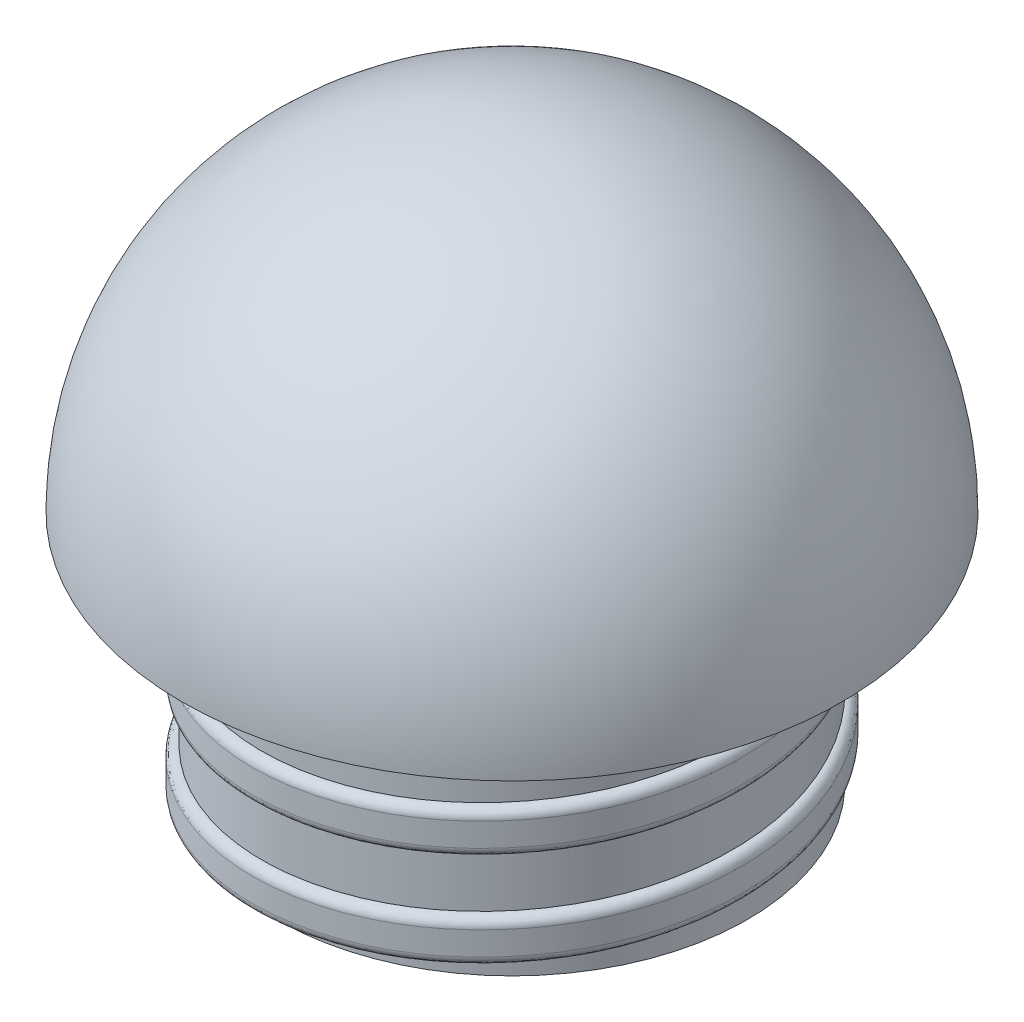
from build123d import *

# Parameters (mm, degrees)
REVOLVE1_ANGLE      = 180
SKETCH2_R           = 5
BOSS_EXTRUDE1_DEPTH = 5
SWEEP1_PITCH        = 2
SKETCH5_W           = 24.567867965
SKETCH5_H           = 1.481381553
CUT_EXTRUDE1_DEPTH  = 25


with BuildPart() as part:
    # Sketch1 → Revolve1 (revolve)
    with BuildSketch(Plane(origin=(0, 0, 0), x_dir=(1, 0, 0), z_dir=(0, 1, 0))):
        with BuildLine():
            Line((-7, 0), (7, 0))
            ThreePointArc((7, 0), (0, 7), (-7, 0))
        make_face()
    revolve(axis=Axis((-7, 0, 0), (1, 0, 0)), revolution_arc=REVOLVE1_ANGLE)

    # Sketch2 → Boss-Extrude1 (add)
    with BuildSketch(Plane(origin=(0, 0, 0), x_dir=(-1, 0, 0), z_dir=(0, -1, 0))):
        with Locations(Location((0, 0, 0), (0, 0, 90))):
            Circle(SKETCH2_R)
    extrude(amount=BOSS_EXTRUDE1_DEPTH)

    # Sweep1: the profile of Sketch4 screwed along a right-hand helix of 2.5 turns, 10 arcs to a turn; built about Z, then put on its axis
    sweep1_z = Axis((0, 0, 0), (0, 0, 1))
    sweep1_corners = [(5.2, 0.01588334, -0.249494929), (5.2, -0.01588334, 0.249494929), (5, -0.028590013, 0.449090872), (4.8, -0.01588334, 0.249494929), (4.8, 0.01588334, -0.249494929), (5, 0.028590013, -0.449090872)]
    with BuildLine(mode=Mode.PRIVATE) as sweep1_profile:
        Line(sweep1_corners[0], sweep1_corners[1])
        Line(sweep1_corners[3], sweep1_corners[4])
        ThreePointArc((5.2, -0.01588334, 0.249494929), (5.141421356, -0.024868315, 0.390630574), (5, -0.028590013, 0.449090872))
        ThreePointArc((5, -0.028590013, 0.449090872), (4.858578644, -0.024868315, 0.390630574), (4.8, -0.01588334, 0.249494929))
        ThreePointArc((4.8, 0.01588334, -0.249494929), (4.858578644, 0.024868315, -0.390630574), (5, 0.028590013, -0.449090872))
        ThreePointArc((5, 0.028590013, -0.449090872), (5.141421356, 0.024868315, -0.390630574), (5.2, 0.01588334, -0.249494929))
    sweep1_cap = Face(sweep1_profile.wire())
    sweep1_arcs = [((5.2, -0.01588334, 0.249494929), (5.2, -0.028590013, 0.449090872), (5, -0.028590013, 0.449090872), (1, 0.7071067811865487, 1)), ((5, -0.028590013, 0.449090872), (4.8, -0.028590013, 0.449090872), (4.8, -0.01588334, 0.249494929), (1, 0.7071067811865487, 1)), ((4.8, 0.01588334, -0.249494929), (4.8, 0.028590013, -0.449090872), (5, 0.028590013, -0.449090872), (1, 0.7071067811865476, 1)), ((5, 0.028590013, -0.449090872), (5.2, 0.028590013, -0.449090872), (5.2, 0.01588334, -0.249494929), (1, 0.7071067811865476, 1))]  # start, shoulder, end, weights
    sweep1_turn_angles = [0, 18, 36, 54, 72, 90, 108, 126, 144, 162, 180, 198, 216, 234, 252, 270, 288, 306, 324, 342, 360]
    sweep1_turn_weights = [1, 0.9510565162951535, 1, 0.9510565162951535, 1, 0.9510565162951535, 1, 0.9510565162951535, 1, 0.9510565162951535, 1, 0.9510565162951535, 1, 0.9510565162951535, 1, 0.9510565162951535, 1, 0.9510565162951535, 1, 0.9510565162951535, 1]
    sweep1_turn_rails = [Edge.make_bspline([Vector(p[0], p[1], 0).rotate(sweep1_z, sweep1_turn_angles[k]) / sweep1_turn_weights[k] + Vector(0, 0, p[2] + SWEEP1_PITCH * sweep1_turn_angles[k] / 360) for k in range(21)], [0, 0, 0, 1, 1, 2, 2, 3, 3, 4, 4, 5, 5, 6, 6, 7, 7, 8, 8, 9, 9, 10, 10, 10], 2, sweep1_turn_weights) for p in sweep1_corners]
    sweep1_turn_sides = [*[Face.make_surface_from_curves(sweep1_turn_rails[p[0]], sweep1_turn_rails[p[1]]) for p in [(0, 1), (3, 4)]], *[Face.make_bezier_surface([[Vector(p[j][0], p[j][1], 0).rotate(sweep1_z, sweep1_turn_angles[2 * i + k]) / sweep1_turn_weights[2 * i + k] + Vector(0, 0, p[j][2] + SWEEP1_PITCH * sweep1_turn_angles[2 * i + k] / 360) for k in range(3)] for j in range(3)], [[p[3][j] * sweep1_turn_weights[2 * i + k] for k in range(3)] for j in range(3)]) for p in sweep1_arcs for i in range(10)]]
    sweep1_last_angles = [720, 738, 756, 774, 792, 810, 828, 846, 864, 882, 900]
    sweep1_last_weights = [1, 0.9510565162951535, 1, 0.9510565162951535, 1, 0.9510565162951535, 1, 0.9510565162951535, 1, 0.9510565162951483, 1]
    sweep1_last_rails = [Edge.make_bspline([Vector(p[0], p[1], 0).rotate(sweep1_z, sweep1_last_angles[k]) / sweep1_last_weights[k] + Vector(0, 0, p[2] + SWEEP1_PITCH * sweep1_last_angles[k] / 360) for k in range(11)], [0, 0, 0, 1, 1, 2, 2, 3, 3, 4, 4, 5, 5, 5], 2, sweep1_last_weights) for p in sweep1_corners]
    sweep1_last_sides = [*[Face.make_surface_from_curves(sweep1_last_rails[p[0]], sweep1_last_rails[p[1]]) for p in [(0, 1), (3, 4)]], *[Face.make_bezier_surface([[Vector(p[j][0], p[j][1], 0).rotate(sweep1_z, sweep1_last_angles[2 * i + k]) / sweep1_last_weights[2 * i + k] + Vector(0, 0, p[j][2] + SWEEP1_PITCH * sweep1_last_angles[2 * i + k] / 360) for k in range(3)] for j in range(3)], [[p[3][j] * sweep1_last_weights[2 * i + k] for k in range(3)] for j in range(3)]) for p in sweep1_arcs for i in range(5)]]
    sweep1 = Plane(origin=(0, -5, 0), x_dir=(-1, 0, 0), z_dir=(0, 1, 0)) * Solid(Shell([*[p.moved(Location((0, 0, SWEEP1_PITCH * i))) for i in range(2) for p in sweep1_turn_sides], *sweep1_last_sides, sweep1_cap, sweep1_cap.rotate(sweep1_z, 900).moved(Location((0, 0, SWEEP1_PITCH * 900 / 360)))]))
    add(sweep1)

    # Sketch5 → Cut-Extrude1 (cut)
    with BuildSketch(Plane.XY.offset(10)):
        with Locations((-7.283933983, -5.740690777)):
            Rectangle(SKETCH5_W, SKETCH5_H)
    extrude(amount=-CUT_EXTRUDE1_DEPTH, mode=Mode.SUBTRACT)


solid = part.part
